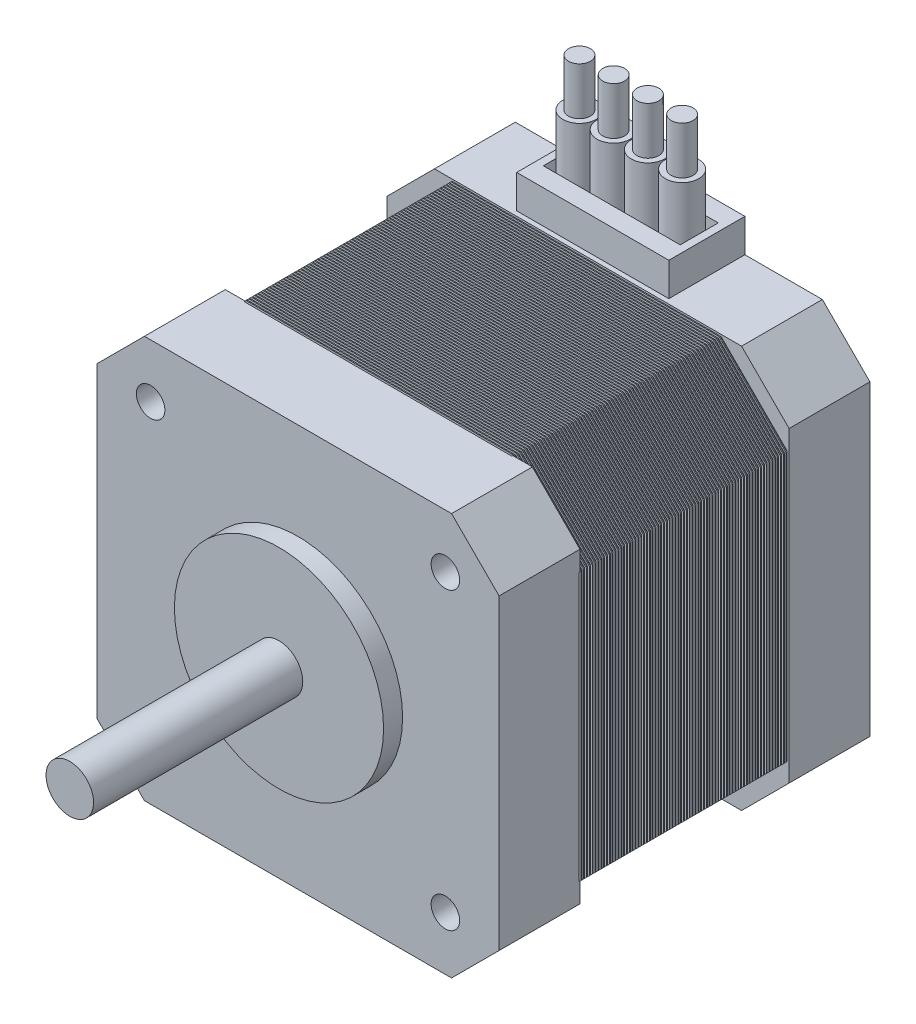
from build123d import *

# Parameters (mm, degrees)
BOSS_EXTRUDE1_DEPTH = 39
SKETCH2_R           = 2.5
BOSS_EXTRUDE2_DEPTH = 24
SKETCH3_R           = 11
BOSS_EXTRUDE3_DEPTH = 2
SKETCH4_R           = 1.5
CUT_EXTRUDE1_DEPTH  = 4.5
CUT_EXTRUDE2_START  = -8.5
CUT_EXTRUDE2_DEPTH  = 22
CUT_EXTRUDE3_DEPTH  = 0.2
LPATTERN1_COUNT     = 74
LPATTERN1_PITCH     = 0.3
SKETCH7_W           = 16
SKETCH7_H           = 8
BOSS_EXTRUDE4_DEPTH = 3.5
SKETCH8_W           = 14.4
SKETCH8_H           = 4
SKETCH8_R           = 1.75
CUT_EXTRUDE4_DEPTH  = 3
BOSS_EXTRUDE5_START = 5
SKETCH9_R           = 1.75
BOSS_EXTRUDE5_DEPTH = 5
SKETCH10_R          = 1.15
BOSS_EXTRUDE6_DEPTH = 5
SCALE1_SCALE        = 0.7


with BuildPart() as part:
    # Sketch1 → Boss-Extrude1 (new body)
    with BuildSketch(Plane.XY):
        Polygon((-21.15, 16.15), (-16.15, 21.15), (16.15, 21.15), (21.15, 16.15), (21.15, -16.15), (16.15, -21.15), (-16.15, -21.15), (-21.15, -16.15), align=None)
    extrude(amount=BOSS_EXTRUDE1_DEPTH)

    # Sketch2 → Boss-Extrude2 (add)
    with BuildSketch(Plane.XY.offset(39)):
        Circle(SKETCH2_R)
    extrude(amount=BOSS_EXTRUDE2_DEPTH)

    # Sketch3 → Boss-Extrude3 (add)
    with BuildSketch(Plane.XY.offset(39)):
        Circle(SKETCH3_R)
    extrude(amount=BOSS_EXTRUDE3_DEPTH)

    # Sketch4 → Cut-Extrude1 (cut)
    with BuildSketch(Plane.XY.offset(39)):
        with Locations((-15.5, 15.5)):
            Circle(SKETCH4_R)
        with Locations((15.5, 15.5)):
            Circle(SKETCH4_R)
        with Locations((15.5, -15.5)):
            Circle(SKETCH4_R)
        with Locations((-15.5, -15.5)):
            Circle(SKETCH4_R)
    extrude(amount=-CUT_EXTRUDE1_DEPTH, mode=Mode.SUBTRACT)

    # Sketch5 → Cut-Extrude2 (cut)
    with BuildSketch(Plane(origin=(0, 0, 0), x_dir=(-1, 0, 0), z_dir=(0, 0, -1)).offset(CUT_EXTRUDE2_START)):
        Polygon((-21.15, 14.078932188), (-14.078932188, 21.15), (-21.15, 21.15), align=None)
        Polygon((14.078932188, 21.15), (21.15, 14.078932188), (21.15, 21.15), align=None)
        Polygon((21.15, -14.078932188), (14.078932188, -21.15), (21.15, -21.15), align=None)
        Polygon((-14.078932188, -21.15), (-21.15, -14.078932188), (-21.15, -21.15), align=None)
    extrude(amount=-CUT_EXTRUDE2_DEPTH, mode=Mode.SUBTRACT)

    # Sketch6 → Cut-Extrude3 (cut)
    with BuildSketch(Plane.XY.offset(8.5)):
        Polygon((-21.15, -14.078932188), (-14.078932188, -21.15), (14.078932188, -21.15), (21.15, -14.078932188), (21.15, 14.078932188), (14.078932188, 21.15), (-14.078932188, 21.15), (-21.15, 14.078932188), align=None)
        Polygon((-20.95, -13.996089476), (-13.996089476, -20.95), (13.996089476, -20.95), (20.95, -13.996089476), (20.95, 13.996089476), (13.996089476, 20.95), (-13.996089476, 20.95), (-20.95, 13.996089476), align=None, mode=Mode.SUBTRACT)
    cut_extrude3 = extrude(amount=CUT_EXTRUDE3_DEPTH, mode=Mode.SUBTRACT)

    # LPattern1: Cut-Extrude3 ×74
    with Locations(*[(0, 0, i * LPATTERN1_PITCH) for i in range(1, LPATTERN1_COUNT)]):
        add(cut_extrude3, mode=Mode.SUBTRACT)

    # Sketch7 → Boss-Extrude4 (add)
    with BuildSketch(Plane(origin=(0, 21.15, 0), x_dir=(1, 0, 0), z_dir=(0, 1, 0))):
        with Locations((0, -4)):
            Rectangle(SKETCH7_W, SKETCH7_H)
    extrude(amount=BOSS_EXTRUDE4_DEPTH)

    # Sketch8 → Cut-Extrude4 (cut)
    with BuildSketch(Plane(origin=(0, 24.65, 0), x_dir=(1, 0, 0), z_dir=(0, 1, 0))):
        with Locations((0, -4)):
            Rectangle(SKETCH8_W, SKETCH8_H)
        with Locations((-5.4, -4)):
            Circle(SKETCH8_R, mode=Mode.SUBTRACT)
        with Locations((-1.8, -4)):
            Circle(SKETCH8_R, mode=Mode.SUBTRACT)
        with Locations((1.8, -4)):
            Circle(SKETCH8_R, mode=Mode.SUBTRACT)
        with Locations((5.4, -4)):
            Circle(SKETCH8_R, mode=Mode.SUBTRACT)
    extrude(amount=-CUT_EXTRUDE4_DEPTH, mode=Mode.SUBTRACT)

    # Sketch9 → Boss-Extrude5 (add)
    with BuildSketch(Plane(origin=(0, 24.65, 0), x_dir=(1, 0, 0), z_dir=(0, 1, 0)).offset(BOSS_EXTRUDE5_START)):
        with Locations((5.4, -4)):
            Circle(SKETCH9_R)
        with Locations((1.8, -4)):
            Circle(SKETCH9_R)
        with Locations((-5.4, -4)):
            Circle(SKETCH9_R)
        with Locations((-1.8, -4)):
            Circle(SKETCH9_R)
    extrude(amount=-BOSS_EXTRUDE5_DEPTH)

    # Sketch10 → Boss-Extrude6 (add)
    with BuildSketch(Plane(origin=(0, 29.65, 0), x_dir=(1, 0, 0), z_dir=(0, 1, 0))):
        with Locations((-5.4, -4)):
            Circle(SKETCH10_R)
        with Locations((-1.8, -4)):
            Circle(SKETCH10_R)
        with Locations((1.8, -4)):
            Circle(SKETCH10_R)
        with Locations((5.4, -4)):
            Circle(SKETCH10_R)
    extrude(amount=BOSS_EXTRUDE6_DEPTH)


with BuildPart() as part_1:
    # Scale1: scaled about (0, 0.24741223, 19.751148)
    add(part.part.scale(SCALE1_SCALE).moved(Location((0, 0.074223669, 5.9253444))))


solid = part_1.part
